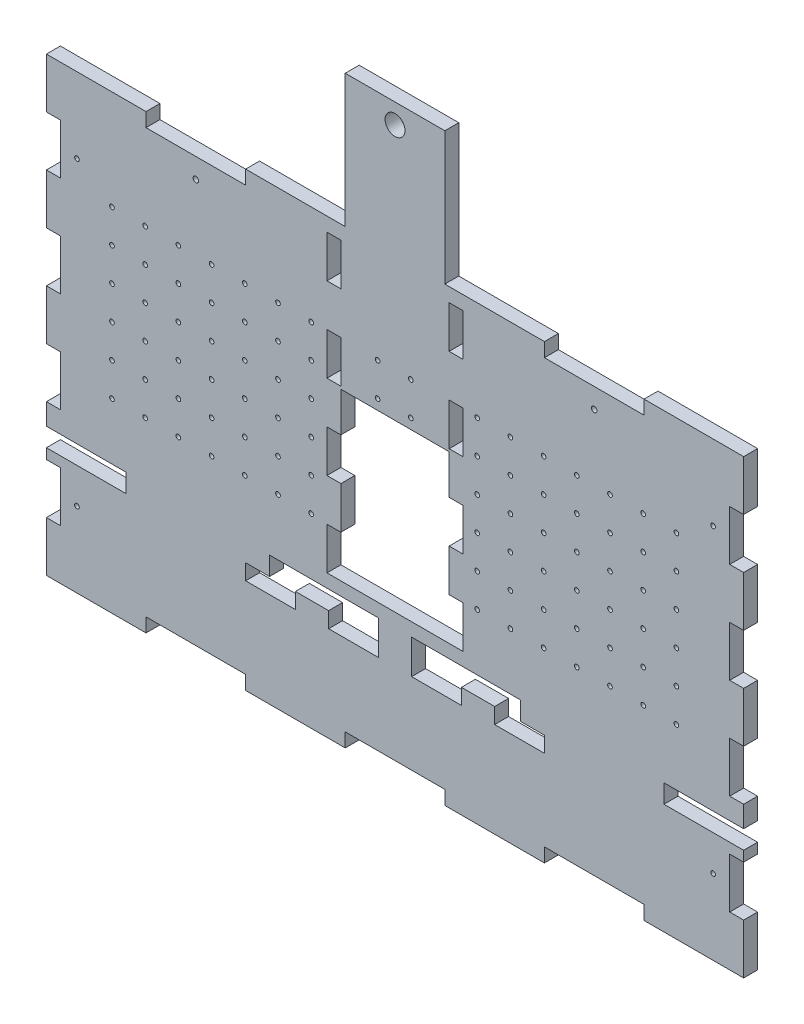
from build123d import *

# Parameters (mm, degrees)
SKETCH1_W           = 266.7
SKETCH1_H           = 172.72
BOSS_EXTRUDE1_DEPTH = 5.334
SKETCH2_W           = 38.1
SKETCH2_H           = 5.334
CUT_EXTRUDE1_DEPTH  = 165.701204222
SKETCH5_W           = 41.656
SKETCH5_H           = 7.112
CUT_EXTRUDE3_DEPTH  = 165.701204222
SKETCH9_W           = 5.334
SKETCH9_H           = 19.191111111
CUT_EXTRUDE7_DEPTH  = 165.701204222
SKETCH10_W          = 38.1
SKETCH10_H          = 5.334
BOSS_EXTRUDE2_DEPTH = 50.8
SKETCH11_W          = 6.604
SKETCH11_H          = 40.64
CUT_EXTRUDE8_DEPTH  = 197.710659379
SKETCH12_R          = 3.81
CUT_EXTRUDE9_DEPTH  = 197.710659379
SKETCH14_R          = 0.889
CUT_EXTRUDE11_DEPTH = 197.710659379
SKETCH15_W          = 6.604
SKETCH15_H          = 10.16
CUT_EXTRUDE12_DEPTH = 197.710659379
SKETCH16_W          = 41.402
SKETCH16_H          = 63.5
CUT_EXTRUDE13_DEPTH = 197.710659379
SKETCH17_W          = 5.334
SKETCH17_H          = 16.124650759
SKETCH17_H_2        = 16.124650758
CUT_EXTRUDE14_DEPTH = 197.710659379
SKETCH18_W          = 38.1
SKETCH18_H          = 56.134
BOSS_EXTRUDE3_DEPTH = 5.334
SKETCH19_W          = 34.756768033
SKETCH19_H          = 54.94363668
CUT_EXTRUDE15_DEPTH = 197.710659379
SKETCH20_R          = 3.81
CUT_EXTRUDE16_DEPTH = 197.710659379
SKETCH21_R          = 0.889
CUT_EXTRUDE17_DEPTH = 197.710659379
SKETCH22_W          = 19.05
SKETCH22_H          = 5.993691658
CUT_EXTRUDE18_DEPTH = 197.710659379
SKETCH23_R          = 1.04775
CUT_EXTRUDE19_DEPTH = 197.710659379


with BuildPart() as part:
    # Sketch1 → Boss-Extrude1 (new body)
    with BuildSketch(Plane.XY):
        with Locations((5.474099752, 2.104142138)):
            Rectangle(SKETCH1_W, SKETCH1_H)
    extrude(amount=BOSS_EXTRUDE1_DEPTH)

    # Sketch2 → Cut-Extrude1 (cut, through all)
    with BuildSketch(Plane.XY.offset(5.334)):
        with Locations((-70.725900248, -81.588857862)):
            Rectangle(SKETCH2_W, SKETCH2_H)
        with Locations((5.474099752, -81.588857862)):
            Rectangle(SKETCH2_W, SKETCH2_H)
        with Locations((81.674099752, -81.588857862)):
            Rectangle(SKETCH2_W, SKETCH2_H)
        with Locations((81.674099752, 85.797142138)):
            Rectangle(SKETCH2_W, SKETCH2_H)
        with Locations((5.474099752, 85.797142138)):
            Rectangle(SKETCH2_W, SKETCH2_H)
        with Locations((-70.725900248, 85.797142138)):
            Rectangle(SKETCH2_W, SKETCH2_H)
    extrude(amount=-CUT_EXTRUDE1_DEPTH, mode=Mode.SUBTRACT)

    # Sketch5 → Cut-Extrude3 (cut, through all)
    with BuildSketch(Plane.XY.offset(5.334)):
        with Locations((32.652099752, -38.378413173)):
            Rectangle(SKETCH5_W, SKETCH5_H)
        with Locations((-21.703900248, -38.378413173)):
            Rectangle(SKETCH5_W, SKETCH5_H)
        with Locations((-118.223900248, -38.378413173)):
            Rectangle(SKETCH5_W, SKETCH5_H)
        with Locations((129.172099752, -38.378413173)):
            Rectangle(SKETCH5_W, SKETCH5_H)
    extrude(amount=-CUT_EXTRUDE3_DEPTH, mode=Mode.SUBTRACT)

    # Sketch9 → Cut-Extrude7 (cut, through all)
    with BuildSketch(Plane.XY.offset(5.334)):
        with Locations((-125.208900248, -55.469191196)):
            Rectangle(SKETCH9_W, SKETCH9_H)
        with Locations((-125.208900248, -17.086968973)):
            Rectangle(SKETCH9_W, SKETCH9_H)
        with Locations((-125.208900248, 21.295253249)):
            Rectangle(SKETCH9_W, SKETCH9_H)
        with Locations((-125.208900248, 59.677475472)):
            Rectangle(SKETCH9_W, SKETCH9_H)
        with Locations((136.157099752, 59.677475472)):
            Rectangle(SKETCH9_W, SKETCH9_H)
        with Locations((136.157099752, 21.295253249)):
            Rectangle(SKETCH9_W, SKETCH9_H)
        with Locations((136.157099752, -17.086968973)):
            Rectangle(SKETCH9_W, SKETCH9_H)
        with Locations((136.157099752, -55.469191196)):
            Rectangle(SKETCH9_W, SKETCH9_H)
    extrude(amount=-CUT_EXTRUDE7_DEPTH, mode=Mode.SUBTRACT)

    # Sketch10 → Boss-Extrude2 (add)
    with BuildSketch(Plane(origin=(0, 88.464142138, 0), x_dir=(1, 0, 0), z_dir=(0, 1, 0))):
        with Locations((43.574099752, -2.667)):
            Rectangle(SKETCH10_W, SKETCH10_H)
    extrude(amount=BOSS_EXTRUDE2_DEPTH)

    # Sketch11 → Cut-Extrude8 (cut, through all)
    with BuildSketch(Plane(origin=(0, 0, 0), x_dir=(-1, 0, 0), z_dir=(0, 0, -1))):
        with Locations((-27.826099752, 108.784142138)):
            Rectangle(SKETCH11_W, SKETCH11_H)
    extrude(amount=-CUT_EXTRUDE8_DEPTH, mode=Mode.SUBTRACT)

    # Sketch12 → Cut-Extrude9 (cut, through all)
    with BuildSketch(Plane.XY.offset(5.334)):
        with Locations((43.574099752, 130.476471297)):
            Circle(SKETCH12_R)
    extrude(amount=-CUT_EXTRUDE9_DEPTH, mode=Mode.SUBTRACT)

    # Sketch14 → Cut-Extrude11 (cut, through all)
    with BuildSketch(Plane.XY.offset(5.334)):
        with Locations((-102.797588144, 50.364142138)):
            Circle(SKETCH14_R)
        with Locations((-90.097588144, 50.364142138)):
            Circle(SKETCH14_R)
        with Locations((-77.397588144, 50.364142138)):
            Circle(SKETCH14_R)
        with Locations((-64.697588144, 50.364142138)):
            Circle(SKETCH14_R)
        with Locations((-51.997588144, 50.364142138)):
            Circle(SKETCH14_R)
        with Locations((-39.297588144, 50.364142138)):
            Circle(SKETCH14_R)
        with Locations((-26.597588144, 50.364142138)):
            Circle(SKETCH14_R)
        with Locations((-1.197588144, 50.364142138)):
            Circle(SKETCH14_R)
        with Locations((11.502411856, 50.364142138)):
            Circle(SKETCH14_R)
        with Locations((36.902411856, 50.364142138)):
            Circle(SKETCH14_R)
        with Locations((49.602411856, 50.364142138)):
            Circle(SKETCH14_R)
        with Locations((62.302411856, 50.364142138)):
            Circle(SKETCH14_R)
        with Locations((75.002411856, 50.364142138)):
            Circle(SKETCH14_R)
        with Locations((87.702411856, 50.364142138)):
            Circle(SKETCH14_R)
        with Locations((100.402411856, 50.364142138)):
            Circle(SKETCH14_R)
        with Locations((113.102411856, 50.364142138)):
            Circle(SKETCH14_R)
        with Locations((-102.797588144, 37.664142138)):
            Circle(SKETCH14_R)
        with Locations((-90.097588144, 37.664142138)):
            Circle(SKETCH14_R)
        with Locations((-77.397588144, 37.664142138)):
            Circle(SKETCH14_R)
        with Locations((-64.697588144, 37.664142138)):
            Circle(SKETCH14_R)
        with Locations((-51.997588144, 37.664142138)):
            Circle(SKETCH14_R)
        with Locations((-39.297588144, 37.664142138)):
            Circle(SKETCH14_R)
        with Locations((-26.597588144, 37.664142138)):
            Circle(SKETCH14_R)
        with Locations((-1.197588144, 37.664142138)):
            Circle(SKETCH14_R)
        with Locations((11.502411856, 37.664142138)):
            Circle(SKETCH14_R)
        with Locations((36.902411856, 37.664142138)):
            Circle(SKETCH14_R)
        with Locations((49.602411856, 37.664142138)):
            Circle(SKETCH14_R)
        with Locations((62.302411856, 37.664142138)):
            Circle(SKETCH14_R)
        with Locations((75.002411856, 37.664142138)):
            Circle(SKETCH14_R)
        with Locations((87.702411856, 37.664142138)):
            Circle(SKETCH14_R)
        with Locations((100.402411856, 37.664142138)):
            Circle(SKETCH14_R)
        with Locations((113.102411856, 37.664142138)):
            Circle(SKETCH14_R)
        with Locations((-102.797588144, 24.964142138)):
            Circle(SKETCH14_R)
        with Locations((-90.097588144, 24.964142138)):
            Circle(SKETCH14_R)
        with Locations((-77.397588144, 24.964142138)):
            Circle(SKETCH14_R)
        with Locations((-64.697588144, 24.964142138)):
            Circle(SKETCH14_R)
        with Locations((-51.997588144, 24.964142138)):
            Circle(SKETCH14_R)
        with Locations((-39.297588144, 24.964142138)):
            Circle(SKETCH14_R)
        with Locations((-26.597588144, 24.964142138)):
            Circle(SKETCH14_R)
        with Locations((-1.197588144, 24.964142138)):
            Circle(SKETCH14_R)
        with Locations((11.502411856, 24.964142138)):
            Circle(SKETCH14_R)
        with Locations((36.902411856, 24.964142138)):
            Circle(SKETCH14_R)
        with Locations((49.602411856, 24.964142138)):
            Circle(SKETCH14_R)
        with Locations((62.302411856, 24.964142138)):
            Circle(SKETCH14_R)
        with Locations((75.002411856, 24.964142138)):
            Circle(SKETCH14_R)
        with Locations((87.702411856, 24.964142138)):
            Circle(SKETCH14_R)
        with Locations((100.402411856, 24.964142138)):
            Circle(SKETCH14_R)
        with Locations((113.102411856, 24.964142138)):
            Circle(SKETCH14_R)
        with Locations((-102.797588144, 12.264142138)):
            Circle(SKETCH14_R)
        with Locations((-90.097588144, 12.264142138)):
            Circle(SKETCH14_R)
        with Locations((-77.397588144, 12.264142138)):
            Circle(SKETCH14_R)
        with Locations((-64.697588144, 12.264142138)):
            Circle(SKETCH14_R)
        with Locations((-51.997588144, 12.264142138)):
            Circle(SKETCH14_R)
        with Locations((-39.297588144, 12.264142138)):
            Circle(SKETCH14_R)
        with Locations((-26.597588144, 12.264142138)):
            Circle(SKETCH14_R)
        with Locations((36.902411856, 12.264142138)):
            Circle(SKETCH14_R)
        with Locations((49.602411856, 12.264142138)):
            Circle(SKETCH14_R)
        with Locations((62.302411856, 12.264142138)):
            Circle(SKETCH14_R)
        with Locations((75.002411856, 12.264142138)):
            Circle(SKETCH14_R)
        with Locations((87.702411856, 12.264142138)):
            Circle(SKETCH14_R)
        with Locations((100.402411856, 12.264142138)):
            Circle(SKETCH14_R)
        with Locations((113.102411856, 12.264142138)):
            Circle(SKETCH14_R)
        with Locations((-102.797588144, -0.435857862)):
            Circle(SKETCH14_R)
        with Locations((-90.097588144, -0.435857862)):
            Circle(SKETCH14_R)
        with Locations((-77.397588144, -0.435857862)):
            Circle(SKETCH14_R)
        with Locations((-64.697588144, -0.435857862)):
            Circle(SKETCH14_R)
        with Locations((-51.997588144, -0.435857862)):
            Circle(SKETCH14_R)
        with Locations((-39.297588144, -0.435857862)):
            Circle(SKETCH14_R)
        with Locations((-26.597588144, -0.435857862)):
            Circle(SKETCH14_R)
        with Locations((-13.897588144, -0.435857862)):
            Circle(SKETCH14_R)
        with Locations((-1.197588144, -0.435857862)):
            Circle(SKETCH14_R)
        with Locations((11.502411856, -0.435857862)):
            Circle(SKETCH14_R)
        with Locations((24.202411856, -0.435857862)):
            Circle(SKETCH14_R)
        with Locations((36.902411856, -0.435857862)):
            Circle(SKETCH14_R)
        with Locations((49.602411856, -0.435857862)):
            Circle(SKETCH14_R)
        with Locations((62.302411856, -0.435857862)):
            Circle(SKETCH14_R)
        with Locations((75.002411856, -0.435857862)):
            Circle(SKETCH14_R)
        with Locations((87.702411856, -0.435857862)):
            Circle(SKETCH14_R)
        with Locations((100.402411856, -0.435857862)):
            Circle(SKETCH14_R)
        with Locations((113.102411856, -0.435857862)):
            Circle(SKETCH14_R)
        with Locations((-102.797588144, -13.135857862)):
            Circle(SKETCH14_R)
        with Locations((-90.097588144, -13.135857862)):
            Circle(SKETCH14_R)
        with Locations((-77.397588144, -13.135857862)):
            Circle(SKETCH14_R)
        with Locations((-64.697588144, -13.135857862)):
            Circle(SKETCH14_R)
        with Locations((-51.997588144, -13.135857862)):
            Circle(SKETCH14_R)
        with Locations((-39.297588144, -13.135857862)):
            Circle(SKETCH14_R)
        with Locations((-26.597588144, -13.135857862)):
            Circle(SKETCH14_R)
        with Locations((-13.897588144, -13.135857862)):
            Circle(SKETCH14_R)
        with Locations((-1.197588144, -13.135857862)):
            Circle(SKETCH14_R)
        with Locations((11.502411856, -13.135857862)):
            Circle(SKETCH14_R)
        with Locations((24.202411856, -13.135857862)):
            Circle(SKETCH14_R)
        with Locations((36.902411856, -13.135857862)):
            Circle(SKETCH14_R)
        with Locations((49.602411856, -13.135857862)):
            Circle(SKETCH14_R)
        with Locations((62.302411856, -13.135857862)):
            Circle(SKETCH14_R)
        with Locations((75.002411856, -13.135857862)):
            Circle(SKETCH14_R)
        with Locations((87.702411856, -13.135857862)):
            Circle(SKETCH14_R)
        with Locations((100.402411856, -13.135857862)):
            Circle(SKETCH14_R)
        with Locations((113.102411856, -13.135857862)):
            Circle(SKETCH14_R)
    extrude(amount=-CUT_EXTRUDE11_DEPTH, mode=Mode.SUBTRACT)

    # Sketch15 → Cut-Extrude12 (cut, through all)
    with BuildSketch(Plane.XY.offset(5.334)):
        with Locations((27.826099752, 134.184142138)):
            Rectangle(SKETCH15_W, SKETCH15_H)
    extrude(amount=-CUT_EXTRUDE12_DEPTH, mode=Mode.SUBTRACT)

    # Sketch16 → Cut-Extrude13 (cut, through all)
    with BuildSketch(Plane.XY.offset(5.334)):
        with Locations((5.474099752, 2.007586827)):
            Rectangle(SKETCH16_W, SKETCH16_H)
    extrude(amount=-CUT_EXTRUDE13_DEPTH, mode=Mode.SUBTRACT)

    # Sketch17 → Cut-Extrude14 (cut, through all)
    with BuildSketch(Plane.XY.offset(5.334)):
        with Locations((-17.893900248, -21.680087794)):
            Rectangle(SKETCH17_W, SKETCH17_H)
        with Locations((-17.893900248, 10.569213724)):
            Rectangle(SKETCH17_W, SKETCH17_H)
        with Locations((-17.893900248, 42.818515241)):
            Rectangle(SKETCH17_W, SKETCH17_H_2)
        with Locations((-17.893900248, 75.067816759)):
            Rectangle(SKETCH17_W, SKETCH17_H)
        with Locations((28.842099752, 75.067816759)):
            Rectangle(SKETCH17_W, SKETCH17_H)
        with Locations((28.842099752, 42.818515241)):
            Rectangle(SKETCH17_W, SKETCH17_H_2)
        with Locations((28.842099752, 10.569213724)):
            Rectangle(SKETCH17_W, SKETCH17_H)
        with Locations((28.842099752, -21.680087794)):
            Rectangle(SKETCH17_W, SKETCH17_H)
    extrude(amount=-CUT_EXTRUDE14_DEPTH, mode=Mode.SUBTRACT)

    # Sketch18 → Boss-Extrude3 (add)
    with BuildSketch(Plane.XY.offset(5.334)):
        with Locations((5.474099752, 111.197142138)):
            Rectangle(SKETCH18_W, SKETCH18_H)
    extrude(amount=-BOSS_EXTRUDE3_DEPTH)

    # Sketch19 → Cut-Extrude15 (cut, through all)
    with BuildSketch(Plane.XY.offset(5.334)):
        with Locations((48.506483768, 115.935960478)):
            Rectangle(SKETCH19_W, SKETCH19_H)
    extrude(amount=-CUT_EXTRUDE15_DEPTH, mode=Mode.SUBTRACT)

    # Sketch20 → Cut-Extrude16 (cut, through all)
    with BuildSketch(Plane.XY.offset(5.334)):
        with Locations((5.474099752, 131.644142138)):
            Circle(SKETCH20_R)
    extrude(amount=-CUT_EXTRUDE16_DEPTH, mode=Mode.SUBTRACT)

    # Sketch21 → Cut-Extrude17 (cut, through all)
    with BuildSketch(Plane.XY.offset(5.334)):
        with Locations((127.140099752, 59.677475471)):
            Circle(SKETCH21_R)
        with Locations((-116.191900248, 59.677475471)):
            Circle(SKETCH21_R)
        with Locations((-116.191900248, -55.469191196)):
            Circle(SKETCH21_R)
        with Locations((127.140099752, -55.469191196)):
            Circle(SKETCH21_R)
    extrude(amount=-CUT_EXTRUDE17_DEPTH, mode=Mode.SUBTRACT)

    # Sketch22 → Cut-Extrude18 (cut, through all)
    with BuildSketch(Plane(origin=(0, 0, 0), x_dir=(-1, 0, 0), z_dir=(0, 0, -1))):
        with Locations((-21.349099752, -44.931259002)):
            Rectangle(SKETCH22_W, SKETCH22_H)
        with Locations((-53.099099752, -44.931259002)):
            Rectangle(SKETCH22_W, SKETCH22_H)
        with Locations((42.150900248, -44.931259002)):
            Rectangle(SKETCH22_W, SKETCH22_H)
        with Locations((10.400900248, -44.931259002)):
            Rectangle(SKETCH22_W, SKETCH22_H)
    extrude(amount=-CUT_EXTRUDE18_DEPTH, mode=Mode.SUBTRACT)

    # Sketch23 → Cut-Extrude19 (cut, through all)
    with BuildSketch(Plane(origin=(0, 0, 0), x_dir=(-1, 0, 0), z_dir=(0, 0, -1))):
        with Locations((-81.674099752, 75.510142138)):
            Circle(SKETCH23_R)
        with Locations((70.725900248, 75.510142138)):
            Circle(SKETCH23_R)
    extrude(amount=-CUT_EXTRUDE19_DEPTH, mode=Mode.SUBTRACT)


solid = part.part
